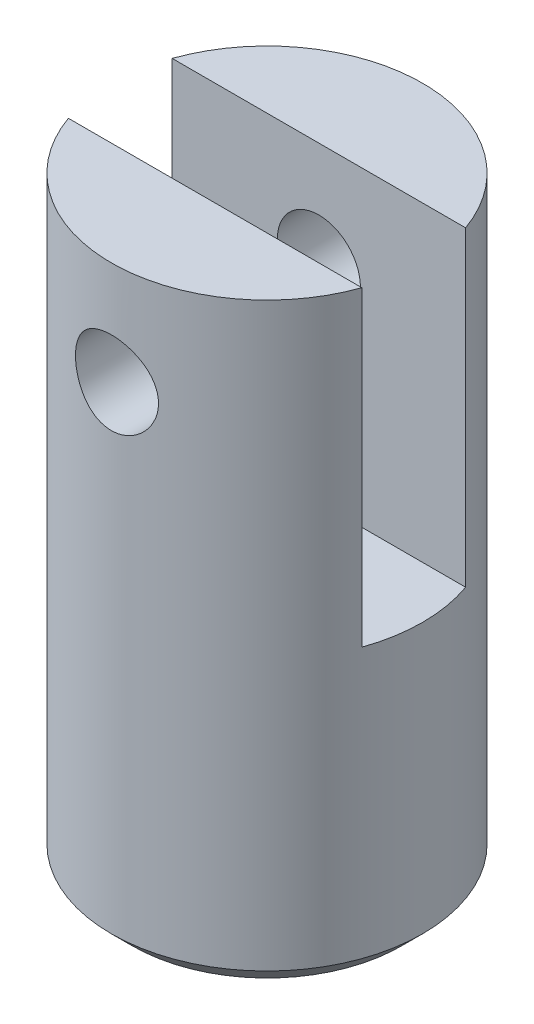
from build123d import *

# Parameters (mm, degrees)
ESBO_O1_R                  = 7.5
RESSALTO_EXTRUS_O1_DEPTH   = 14.5
CORTE_EXTRUS_O1_DEPTH      = 18.965244223
CORTE_EXTRUS_O1_DEPTH_BACK = 18.965244223
ESBO_O2_W                  = 5
ESBO_O2_H                  = 15
CORTE_EXTRUS_O2_DEPTH      = 18.965244223
CORTE_EXTRUS_O2_DEPTH_BACK = 18.965244223
ESBO_O3_R                  = 2
CHANFRO1_SIZE              = 1


with BuildPart() as part:
    # Esboço1 → Ressalto-extrusão1 (new, symmetric)
    with BuildSketch(Plane(origin=(0, 0, 0), x_dir=(1, 0, 0), z_dir=(0, 1, 0))):
        Circle(ESBO_O1_R)
    extrude(amount=RESSALTO_EXTRUS_O1_DEPTH, both=True)

    # Esboço2 → Corte-extrusão1 (cut, two sides: drawn at the far end of the back side and taken through both)
    with BuildSketch(Plane(origin=(0, 0, 0), x_dir=(0, 0, -1), z_dir=(1, 0, 0)).offset(-CORTE_EXTRUS_O1_DEPTH_BACK)):
        with Locations((0, 7)):
            Rectangle(ESBO_O2_W, ESBO_O2_H)
    extrude(amount=CORTE_EXTRUS_O1_DEPTH + CORTE_EXTRUS_O1_DEPTH_BACK, mode=Mode.SUBTRACT)

    # Esboço3 → Corte-extrusão2 (cut, two sides: drawn at the far end of the back side and taken through both)
    with BuildSketch(Plane.XY.offset(-CORTE_EXTRUS_O2_DEPTH_BACK)):
        with Locations((0, 9.5)):
            Circle(ESBO_O3_R)
    extrude(amount=CORTE_EXTRUS_O2_DEPTH + CORTE_EXTRUS_O2_DEPTH_BACK, mode=Mode.SUBTRACT)

    # Chanfro1
    chanfro1_edges = [part.edges().sort_by_distance(p)[0] for p in [
        (-7.5, -14.5, 0),
    ]]
    chamfer(chanfro1_edges, length=CHANFRO1_SIZE)


solid = part.part
